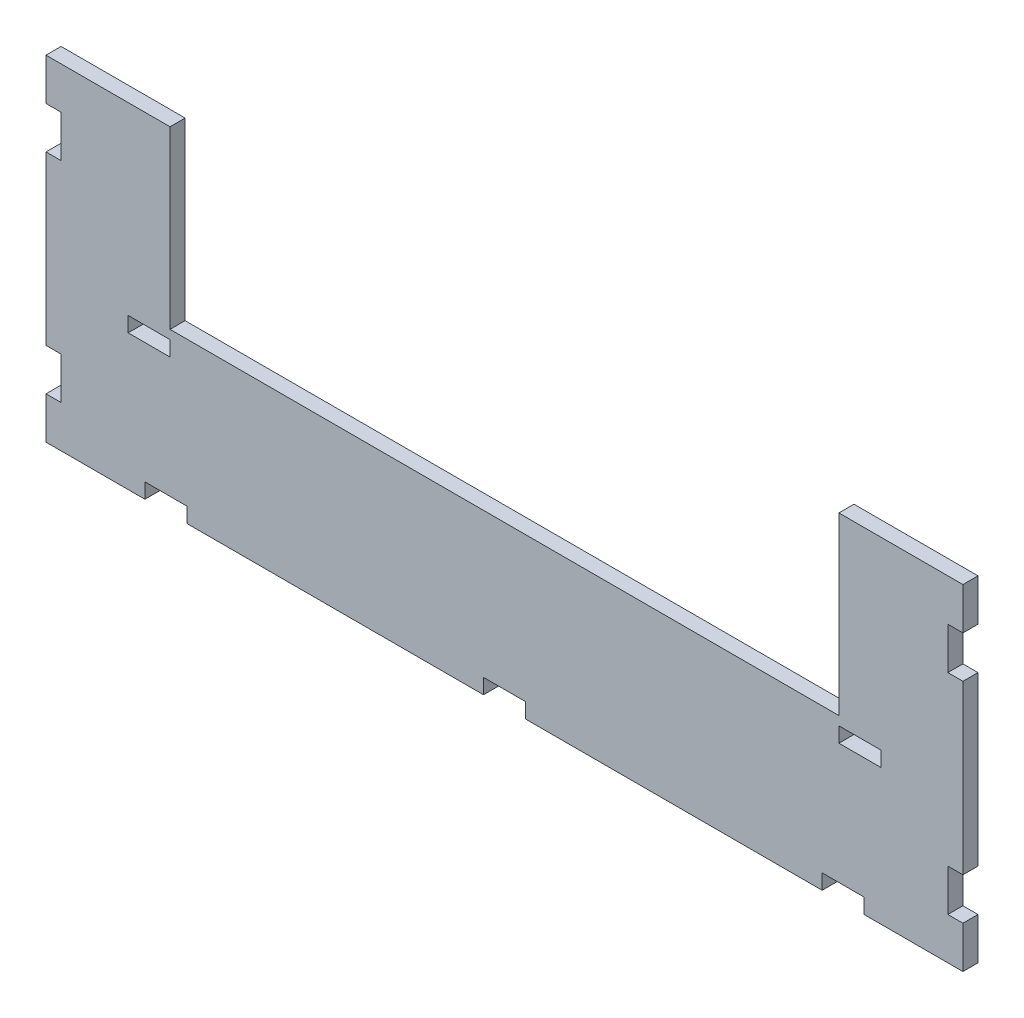
from build123d import *

# Parameters (mm, degrees)
SKETCH1_W           = 1094.236516538
SKETCH1_H           = 400
BOSS_EXTRUDE1_DEPTH = 18
CAVITY1_START       = -15
CAVITY1_OUTLINE_W   = 18
CAVITY1_OUTLINE_H   = 18
CAVITY1_DEPTH       = 30
CAVITY1_START_2     = 813.236516538
CAVITY1_2_OUTLINE_W = 18
CAVITY1_2_OUTLINE_H = 18
CAVITY1_2_DEPTH     = 30
CAVITY1_START_3     = 389.118258269
CAVITY1_3_OUTLINE_W = 18
CAVITY1_3_OUTLINE_H = 18
CAVITY1_3_DEPTH     = 50
CAVITY1_START_4     = -35
CAVITY1_4_OUTLINE_W = 18
CAVITY1_4_OUTLINE_H = 18
CAVITY1_4_DEPTH     = 20
CAVITY1_START_5     = 15
CAVITY1_5_OUTLINE_W = 18
CAVITY1_5_OUTLINE_H = 18
CAVITY1_5_DEPTH     = 20
CAVITY1_START_6     = 793.236516538
CAVITY1_6_OUTLINE_W = 18
CAVITY1_6_OUTLINE_H = 18
CAVITY1_6_DEPTH     = 20
CAVITY1_START_7     = 843.236516538
CAVITY1_7_OUTLINE_W = 18
CAVITY1_7_OUTLINE_H = 18
CAVITY1_7_DEPTH     = 20
SKETCH2_W           = 18
SKETCH2_H           = 50
CUT_EXTRUDE1_DEPTH  = 987.255362837
SKETCH3_W           = 798.236516538
SKETCH3_H           = 209.4
CUT_EXTRUDE2_DEPTH  = 18


# Read off the part's stored shape, not the designer's step: Cavity1
with BuildPart() as part:
    # Sketch1 → Boss-Extrude1 (new body)
    with BuildSketch(Plane.XY):
        with Locations((414.118258269, 20)):
            Rectangle(SKETCH1_W, SKETCH1_H)
    extrude(amount=BOSS_EXTRUDE1_DEPTH)

    # Cavity1 outline → Cavity1 (cut)
    with BuildSketch(Plane.YZ.offset(CAVITY1_START)):
        with Locations((-9, 9)):
            Rectangle(CAVITY1_OUTLINE_W, CAVITY1_OUTLINE_H)
        with Locations((-171, 9)):
            Rectangle(CAVITY1_OUTLINE_W, CAVITY1_OUTLINE_H)
    extrude(amount=CAVITY1_DEPTH, mode=Mode.SUBTRACT)

    # Cavity1 2 outline → Cavity1 2 (cut)
    with BuildSketch(Plane.YZ.offset(CAVITY1_START_2)):
        with Locations((-9, 9)):
            Rectangle(CAVITY1_2_OUTLINE_W, CAVITY1_2_OUTLINE_H)
        with Locations((-171, 9)):
            Rectangle(CAVITY1_2_OUTLINE_W, CAVITY1_2_OUTLINE_H)
    extrude(amount=CAVITY1_2_DEPTH, mode=Mode.SUBTRACT)

    # Cavity1 3 outline → Cavity1 3 (cut)
    with BuildSketch(Plane.YZ.offset(CAVITY1_START_3)):
        with Locations((-171, 9)):
            Rectangle(CAVITY1_3_OUTLINE_W, CAVITY1_3_OUTLINE_H)
    extrude(amount=CAVITY1_3_DEPTH, mode=Mode.SUBTRACT)

    # Cavity1 4 outline → Cavity1 4 (cut)
    with BuildSketch(Plane.YZ.offset(CAVITY1_START_4)):
        with Locations((-9, 9)):
            Rectangle(CAVITY1_4_OUTLINE_W, CAVITY1_4_OUTLINE_H)
    extrude(amount=CAVITY1_4_DEPTH, mode=Mode.SUBTRACT)

    # Cavity1 5 outline → Cavity1 5 (cut)
    with BuildSketch(Plane.YZ.offset(CAVITY1_START_5)):
        with Locations((-171, 9)):
            Rectangle(CAVITY1_5_OUTLINE_W, CAVITY1_5_OUTLINE_H)
    extrude(amount=CAVITY1_5_DEPTH, mode=Mode.SUBTRACT)

    # Cavity1 6 outline → Cavity1 6 (cut)
    with BuildSketch(Plane.YZ.offset(CAVITY1_START_6)):
        with Locations((-171, 9)):
            Rectangle(CAVITY1_6_OUTLINE_W, CAVITY1_6_OUTLINE_H)
    extrude(amount=CAVITY1_6_DEPTH, mode=Mode.SUBTRACT)

    # Cavity1 7 outline → Cavity1 7 (cut)
    with BuildSketch(Plane.YZ.offset(CAVITY1_START_7)):
        with Locations((-9, 9)):
            Rectangle(CAVITY1_7_OUTLINE_W, CAVITY1_7_OUTLINE_H)
    extrude(amount=CAVITY1_7_DEPTH, mode=Mode.SUBTRACT)

    # Sketch2 → Cut-Extrude1 (cut, through all)
    with BuildSketch(Plane.XY.offset(18)):
        with Locations((952.236516538, 145)):
            Rectangle(SKETCH2_W, SKETCH2_H)
        with Locations((952.236516538, -105)):
            Rectangle(SKETCH2_W, SKETCH2_H)
        with Locations((-124, -105)):
            Rectangle(SKETCH2_W, SKETCH2_H)
        with Locations((-124, 145)):
            Rectangle(SKETCH2_W, SKETCH2_H)
    extrude(amount=-CUT_EXTRUDE1_DEPTH, mode=Mode.SUBTRACT)

    # Sketch3 → Cut-Extrude2 (cut)
    with BuildSketch(Plane.XY.offset(18)):
        with Locations((414.118258269, 115.3)):
            Rectangle(SKETCH3_W, SKETCH3_H)
    extrude(amount=-CUT_EXTRUDE2_DEPTH, mode=Mode.SUBTRACT)


solid = part.part
